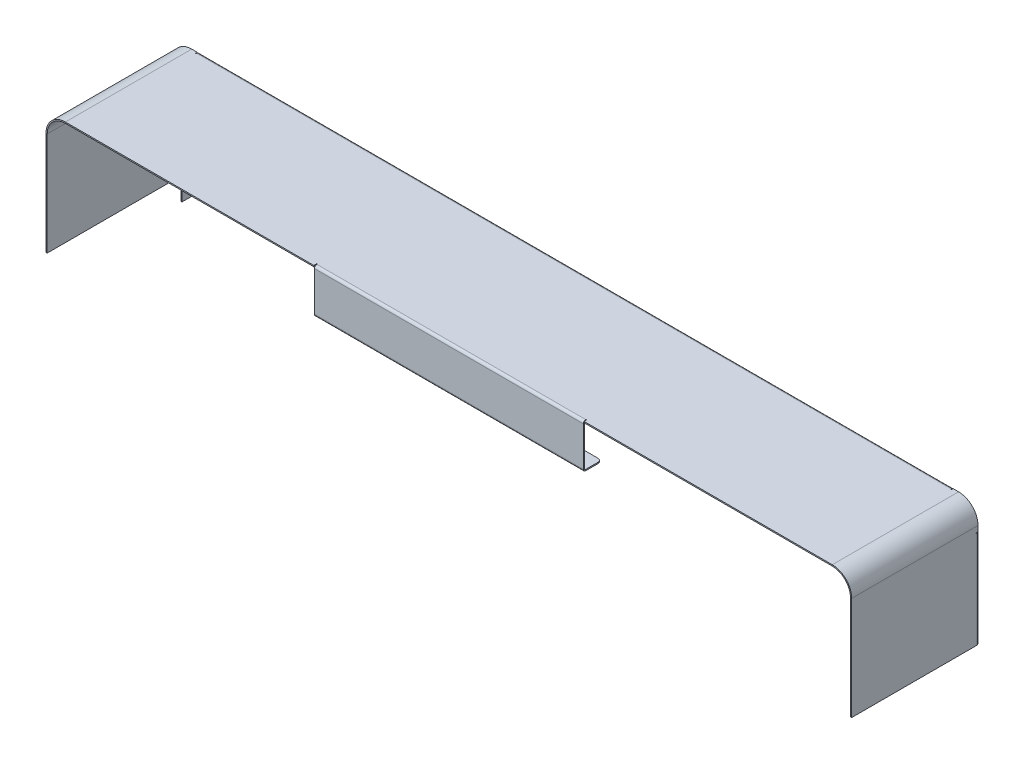
from build123d import *

# Parameters (mm, degrees)
BASE_FLANGE1_DEPTH             = 104
EDGE_FLANGE1_STRIP_W           = 6
EDGE_FLANGE1_STRIP_H           = 1
EDGE_FLANGE1_STRIP_CUT_DEPTH   = 621.4
EDGE_FLANGE1_RELIEF_W          = 6.5
EDGE_FLANGE1_RELIEF_H          = 0.5
EDGE_FLANGE1_RELIEF_CUT_DEPTH  = 1
EDGE_FLANGE1_DEPTH             = 621.4
EDGE_FLANGE2_STRIP_W           = 6
EDGE_FLANGE2_STRIP_H           = 1
EDGE_FLANGE2_STRIP_CUT_DEPTH   = 621.4
EDGE_FLANGE2_DEPTH             = 621.4
EDGE_FLANGE3_STRIP_W           = 6
EDGE_FLANGE3_STRIP_H           = 1
EDGE_FLANGE3_STRIP_CUT_DEPTH   = 80
EDGE_FLANGE3_RELIEF_W          = 6.5
EDGE_FLANGE3_RELIEF_H          = 0.5
EDGE_FLANGE3_RELIEF_CUT_DEPTH  = 1
EDGE_FLANGE3_DEPTH             = 80
EDGE_FLANGE4_STRIP_W           = 6
EDGE_FLANGE4_STRIP_H           = 1
EDGE_FLANGE4_STRIP_CUT_DEPTH   = 80
EDGE_FLANGE4_DEPTH             = 80
EDGE_FLANGE5_STRIP_W           = 6
EDGE_FLANGE5_STRIP_H           = 1
EDGE_FLANGE5_STRIP_CUT_DEPTH   = 221.4
EDGE_FLANGE5_RELIEF_W          = 6.5
EDGE_FLANGE5_RELIEF_H          = 0.5
EDGE_FLANGE5_RELIEF_CUT_DEPTH  = 1
EDGE_FLANGE5_DEPTH             = 221.4
SKETCH22_R                     = 2.5
CUT_EXTRUDE1_DEPTH             = 1
SKETCH23_R                     = 2.5
CUT_EXTRUDE2_DEPTH             = 3
CUT_EXTRUDE2_DIRECTION_2_REACH = 661.378
EDGE_FLANGE6_STRIP_W           = 6
EDGE_FLANGE6_STRIP_H           = 1
EDGE_FLANGE6_STRIP_CUT_DEPTH   = 221.4
EDGE_FLANGE6_DEPTH             = 221.4
EDGE_FLANGE6_FLAT_DEPTH        = 1


# Sheet-metal steps are written as plain solids
with BuildPart() as part:
    # Sketch1 → Base-Flange1 (new body)
    with BuildSketch(Plane.XY):
        with BuildLine():
            Line((-330.7, -100), (-330.7, -15))
            ThreePointArc((-330.7, -15), (-326.306601718, -4.393398282), (-315.7, 0))
            Line((-315.7, 0), (315.7, 0))
            ThreePointArc((315.7, 0), (326.306601718, -4.393398282), (330.7, -15))
            Line((330.7, -15), (330.7, -100))
            Line((330.7, -100), (331.7, -100))
            Line((331.7, -100), (331.7, -15))
            ThreePointArc((331.7, -15), (327.013708499, -3.686291501), (315.7, 1))
            Line((315.7, 1), (-315.7, 1))
            ThreePointArc((-315.7, 1), (-327.013708499, -3.686291501), (-331.7, -15))
            Line((-331.7, -15), (-331.7, -100))
            Line((-331.7, -100), (-330.7, -100))
        make_face()
    extrude(amount=BASE_FLANGE1_DEPTH)

    # Edge-Flange1 strip (across the edge) → Edge-Flange1 strip cut (cut)
    with BuildSketch(Plane(origin=(-310.7, 0, 0), x_dir=(0, 0, 1), z_dir=(1, 0, 0))):
        with Locations((-2, -0.5)):
            Rectangle(EDGE_FLANGE1_STRIP_W, EDGE_FLANGE1_STRIP_H)
    extrude(amount=EDGE_FLANGE1_STRIP_CUT_DEPTH, mode=Mode.SUBTRACT)

    # Edge-Flange1 relief (on the sheet) → Edge-Flange1 relief cut (cut)
    with BuildSketch(Plane(origin=(-310.7, 0, 1), x_dir=(0, 0, 1), z_dir=(0, -1, 0))):
        with Locations((-2.75, 0.25)):
            Rectangle(EDGE_FLANGE1_RELIEF_W, EDGE_FLANGE1_RELIEF_H)
        with Locations((-2.75, -621.65)):
            Rectangle(EDGE_FLANGE1_RELIEF_W, EDGE_FLANGE1_RELIEF_H)
    extrude(amount=-EDGE_FLANGE1_RELIEF_CUT_DEPTH, mode=Mode.SUBTRACT)

    # Edge-Flange1 section (across the edge) → Edge-Flange1 (add)
    with BuildSketch(Plane(origin=(-310.7, 0, 0), x_dir=(0, 0, 1), z_dir=(1, 0, 0))):
        with BuildLine():
            Line((-1, 1), (-1, 19))
            Line((-1, 19), (0, 19))
            Line((0, 19), (0, 1))
            ThreePointArc((0, 1), (0.292893219, 0.292893219), (1, 0))
            Line((1, 0), (1, -1))
            ThreePointArc((1, -1), (-0.414213562, -0.414213562), (-1, 1))
        make_face()
    extrude(amount=EDGE_FLANGE1_DEPTH)

    # Edge-Flange2 strip (across the edge) → Edge-Flange2 strip cut (cut)
    with BuildSketch(Plane(origin=(-310.7, -19, 0), x_dir=(0, 1, 0), z_dir=(1, 0, 0))):
        with Locations((-1, -0.5)):
            Rectangle(EDGE_FLANGE2_STRIP_W, EDGE_FLANGE2_STRIP_H)
    extrude(amount=EDGE_FLANGE2_STRIP_CUT_DEPTH, mode=Mode.SUBTRACT)

    # Edge-Flange2 section (across the edge) → Edge-Flange2 (add)
    with BuildSketch(Plane(origin=(-310.7, -19, 0), x_dir=(0, 1, 0), z_dir=(1, 0, 0))):
        with BuildLine():
            Line((0, 1), (0, 12))
            Line((0, 12), (1, 12))
            Line((1, 12), (1, 1))
            ThreePointArc((1, 1), (1.292893219, 0.292893219), (2, 0))
            Line((2, 0), (2, -1))
            ThreePointArc((2, -1), (0.585786438, -0.414213562), (0, 1))
        make_face()
    extrude(amount=EDGE_FLANGE2_DEPTH)

    # Edge-Flange3 strip (across the edge) → Edge-Flange3 strip cut (cut)
    with BuildSketch(Plane(origin=(-330.7, -100, 0), x_dir=(0, 0, 1), z_dir=(0, 1, 0))):
        with Locations((-2, -0.5)):
            Rectangle(EDGE_FLANGE3_STRIP_W, EDGE_FLANGE3_STRIP_H)
    edge_flange3_strip_cut = extrude(amount=EDGE_FLANGE3_STRIP_CUT_DEPTH, mode=Mode.SUBTRACT)

    # Edge-Flange3 relief (on the sheet) → Edge-Flange3 relief cut (cut)
    with BuildSketch(Plane(origin=(-330.7, -100, 1), x_dir=(0, 0, 1), z_dir=(1, 0, 0))):
        with Locations((-2.75, -80.25)):
            Rectangle(EDGE_FLANGE3_RELIEF_W, EDGE_FLANGE3_RELIEF_H)
    edge_flange3_relief_cut = extrude(amount=-EDGE_FLANGE3_RELIEF_CUT_DEPTH, mode=Mode.SUBTRACT)

    # Edge-Flange3 section (across the edge) → Edge-Flange3 (add)
    with BuildSketch(Plane(origin=(-330.7, -100, 0), x_dir=(0, 0, 1), z_dir=(0, 1, 0))):
        with BuildLine():
            Line((-1, 1), (-1, 19))
            Line((-1, 19), (0, 19))
            Line((0, 19), (0, 1))
            ThreePointArc((0, 1), (0.292893219, 0.292893219), (1, 0))
            Line((1, 0), (1, -1))
            ThreePointArc((1, -1), (-0.414213562, -0.414213562), (-1, 1))
        make_face()
    edge_flange3 = extrude(amount=EDGE_FLANGE3_DEPTH)

    # Edge-Flange4 strip (across the edge) → Edge-Flange4 strip cut (cut)
    with BuildSketch(Plane(origin=(-311.7, -100, 0), x_dir=(-1, 0, 0), z_dir=(0, 1, 0))):
        with Locations((-1, -0.5)):
            Rectangle(EDGE_FLANGE4_STRIP_W, EDGE_FLANGE4_STRIP_H)
    edge_flange4_strip_cut = extrude(amount=EDGE_FLANGE4_STRIP_CUT_DEPTH, mode=Mode.SUBTRACT)

    # Edge-Flange4 section (across the edge) → Edge-Flange4 (add)
    with BuildSketch(Plane(origin=(-311.7, -100, 0), x_dir=(-1, 0, 0), z_dir=(0, 1, 0))):
        with BuildLine():
            Line((0, 1), (0, 12))
            Line((0, 12), (1, 12))
            Line((1, 12), (1, 1))
            ThreePointArc((1, 1), (1.292893219, 0.292893219), (2, 0))
            Line((2, 0), (2, -1))
            ThreePointArc((2, -1), (0.585786438, -0.414213562), (0, 1))
        make_face()
    edge_flange4 = extrude(amount=EDGE_FLANGE4_DEPTH)

    # Mirror1: Edge-Flange3 strip cut, Edge-Flange3 relief cut, Edge-Flange3, Edge-Flange4 strip cut, Edge-Flange4 across plane
    add(edge_flange3_strip_cut.mirror(Plane(origin=(0, 0, 0), x_dir=(0, 0, 1), z_dir=(1, 0, 0))), mode=Mode.SUBTRACT)
    add(edge_flange3_relief_cut.mirror(Plane(origin=(0, 0, 0), x_dir=(0, 0, 1), z_dir=(1, 0, 0))), mode=Mode.SUBTRACT)
    add(edge_flange3.mirror(Plane(origin=(0, 0, 0), x_dir=(0, 0, 1), z_dir=(1, 0, 0))))
    add(edge_flange4_strip_cut.mirror(Plane(origin=(0, 0, 0), x_dir=(0, 0, 1), z_dir=(1, 0, 0))), mode=Mode.SUBTRACT)
    add(edge_flange4.mirror(Plane(origin=(0, 0, 0), x_dir=(0, 0, 1), z_dir=(1, 0, 0))))

    # Edge-Flange5 strip (across the edge) → Edge-Flange5 strip cut (cut)
    with BuildSketch(Plane(origin=(110.7, 0, 104), x_dir=(0, 0, -1), z_dir=(-1, 0, 0))):
        with Locations((-1, -0.5)):
            Rectangle(EDGE_FLANGE5_STRIP_W, EDGE_FLANGE5_STRIP_H)
    extrude(amount=EDGE_FLANGE5_STRIP_CUT_DEPTH, mode=Mode.SUBTRACT)

    # Edge-Flange5 relief (on the sheet) → Edge-Flange5 relief cut (cut)
    with BuildSketch(Plane(origin=(110.7, 0, 102), x_dir=(0, 0, -1), z_dir=(0, -1, 0))):
        with Locations((-2.75, 0.25)):
            Rectangle(EDGE_FLANGE5_RELIEF_W, EDGE_FLANGE5_RELIEF_H)
        with Locations((-2.75, -221.65)):
            Rectangle(EDGE_FLANGE5_RELIEF_W, EDGE_FLANGE5_RELIEF_H)
    extrude(amount=-EDGE_FLANGE5_RELIEF_CUT_DEPTH, mode=Mode.SUBTRACT)

    # Edge-Flange5 section (across the edge) → Edge-Flange5 (add)
    with BuildSketch(Plane(origin=(110.7, 0, 104), x_dir=(0, 0, -1), z_dir=(-1, 0, 0))):
        with BuildLine():
            Line((0, 1), (0, 35.5))
            Line((0, 35.5), (1, 35.5))
            Line((1, 35.5), (1, 1))
            ThreePointArc((1, 1), (1.292893219, 0.292893219), (2, 0))
            Line((2, 0), (2, -1))
            ThreePointArc((2, -1), (0.585786438, -0.414213562), (0, 1))
        make_face()
    extrude(amount=EDGE_FLANGE5_DEPTH)

    # Sketch22 → Cut-Extrude1 (cut)
    with BuildSketch(Plane.XZ.offset(19)):
        with Locations(Location((-249.7, 6, 0), (0, 0, 270))):
            Circle(SKETCH22_R)
        with Locations(Location((-69.7, 6, 0), (0, 0, 270))):
            Circle(SKETCH22_R)
        with Locations(Location((110.3, 6, 0), (0, 0, 270))):
            Circle(SKETCH22_R)
        with Locations(Location((290.3, 6, 0), (0, 0, 270))):
            Circle(SKETCH22_R)
        with Locations((470.3, 6)):
            Circle(SKETCH22_R)
        with Locations((650.3, 6)):
            Circle(SKETCH22_R)
        with Locations((830.3, 6)):
            Circle(SKETCH22_R)
    extrude(amount=-CUT_EXTRUDE1_DEPTH, mode=Mode.SUBTRACT)

    # Sketch23 → Cut-Extrude2 (cut)
    with BuildSketch(Plane.ZY.offset(-311.7)):
        with Locations(Location((6, -68, 0), (0, 0, 180))):
            Circle(SKETCH23_R)
    extrude(amount=-CUT_EXTRUDE2_DEPTH, mode=Mode.SUBTRACT)

    # Cut-Extrude2 direction 2: up to this face of the body (flat: up to its plane)
    cut_extrude2_direction_2_end = Plane(part.part.faces().sort_by_distance((-312.7, -60, 6.5))[0])
    # Sketch23 → Cut-Extrude2 direction 2 (cut, up to the picked face)
    with BuildSketch(Plane.ZY.offset(-311.7), mode=Mode.PRIVATE) as cut_extrude2_direction_2_sk1:
        with Locations(Location((6, -68, 0), (0, 0, 180))):
            Circle(SKETCH23_R)
    cut_extrude2_direction_2_tool1 = split(extrude(cut_extrude2_direction_2_sk1.sketch, amount=CUT_EXTRUDE2_DIRECTION_2_REACH, mode=Mode.PRIVATE), bisect_by=cut_extrude2_direction_2_end, keep=Keep.BOTH, mode=Mode.PRIVATE)
    add(cut_extrude2_direction_2_tool1.solids().sort_by(Axis((311.7, -68, 6), (-1, 0, 0)))[0], mode=Mode.SUBTRACT)

    # Edge-Flange6 strip (across the edge) → Edge-Flange6 strip cut (cut)
    with BuildSketch(Plane(origin=(110.7, -35.5, 103), x_dir=(0, 1, 0), z_dir=(-1, 0, 0))):
        with Locations((-1, -0.5)):
            Rectangle(EDGE_FLANGE6_STRIP_W, EDGE_FLANGE6_STRIP_H)
    extrude(amount=EDGE_FLANGE6_STRIP_CUT_DEPTH, mode=Mode.SUBTRACT)

    # Edge-Flange6 bend section (across the edge) → Edge-Flange6 (add)
    with BuildSketch(Plane(origin=(110.7, -35.5, 103), x_dir=(0, 1, 0), z_dir=(-1, 0, 0))):
        with BuildLine():
            Line((0, 1), (1, 1))
            ThreePointArc((1, 1), (1.292893219, 0.292893219), (2, 0))
            Line((2, 0), (2, -1))
            ThreePointArc((2, -1), (0.585786438, -0.414213562), (0, 1))
        make_face()
    extrude(amount=EDGE_FLANGE6_DEPTH)

    # Edge-Flange6 profile (on flange) → Edge-Flange6 flat (add)
    with BuildSketch(Plane(origin=(0, -35.5, 103), x_dir=(1, 0, 0), z_dir=(0, 1, 0))):
        with BuildLine():
            Line((-110.7, 1), (110.7, 1))
            Line((110.7, 1), (110.7, 11))
            ThreePointArc((110.7, 11), (109.821320344, 13.121320344), (107.7, 14))
            Line((107.7, 14), (-107.7, 14))
            ThreePointArc((-107.7, 14), (-109.821320344, 13.121320344), (-110.7, 11))
            Line((-110.7, 11), (-110.7, 1))
        make_face()
    extrude(amount=EDGE_FLANGE6_FLAT_DEPTH)


solid = part.part
